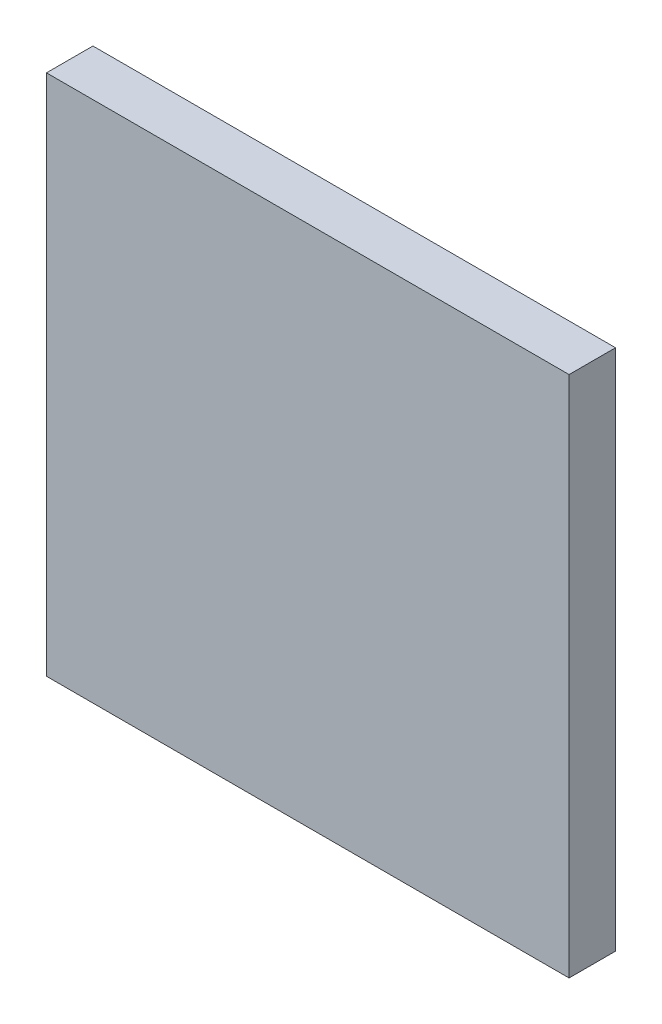
from build123d import *

# Parameters (mm, degrees)
SKETCH_1_W      = 90
SKETCH_1_H      = 90
EXTRUDE_1_DEPTH = 8


with BuildPart() as part:
    # 草图1 → 凸台-拉伸1 (new body)
    with BuildSketch(Plane.XY):
        with Locations((45, 45)):
            Rectangle(SKETCH_1_W, SKETCH_1_H)
    extrude(amount=EXTRUDE_1_DEPTH)


solid = part.part
